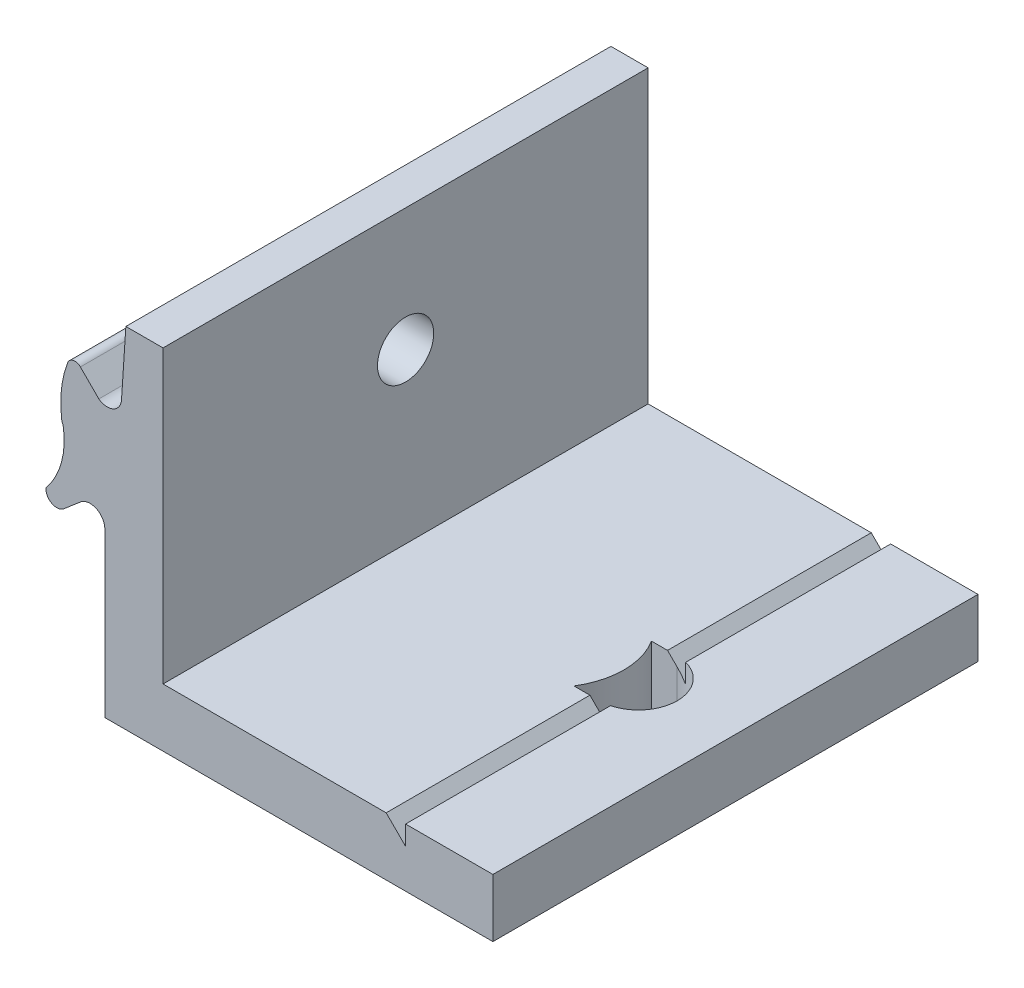
from build123d import *

# Parameters (mm, degrees)
CUT_EXTRUDE1_START        = 15
CUT_EXTRUDE1_DEPTH        = 10.5
CUT_EXTRUDE1_START_2      = 25.5
CUT_EXTRUDE1_2_DEPTH      = 4
CUT_EXTRUDE1_START_3      = -5
CUT_EXTRUDE1_3_DEPTH      = 3.568757805
BOSS_EXTRUDE1_DEPTH       = 0.5
BOSS_EXTRUDE2_DEPTH       = 0.5
SKETCH4_W                 = 14.5
SKETCH4_H                 = 15
CUT_EXTRUDE2_DEPTH        = 10.672144385
BOSS_EXTRUDE3_DEPTH       = 10.5
F_3_CLEARANCE_HOLE1_D     = 2.9
F_3_CLEARANCE_HOLE1_DEPTH = 6.031783808


with BuildPart() as part:
    # Cut-Extrude1: read off the stored shape, not the designer's step
    # Cut-Extrude1 outline → Cut-Extrude1 (new body)
    with BuildSketch(Plane.XY.offset(CUT_EXTRUDE1_START)):
        with BuildLine():
            Line((337.250458866, -1.431242195), (336.422603251, -1.431242195))
            Line((336.422603251, -1.431242195), (336.422603251, 13.568757805))
            Line((336.422603251, 13.568757805), (323.834138276, 13.568757805))
            Line((323.834138276, 13.568757805), (323.608997572, 10.166078708))
            ThreePointArc((323.608997572, 10.166078708), (323.181382472, 9.560091757), (322.443572772, 9.635667582))
            Line((322.443572772, 9.635667582), (321.491292518, 10.587947835))
            ThreePointArc((321.491292518, 10.587947835), (321.1243382, 10.696161689), (320.834327975, 10.446642593))
            ThreePointArc((320.834327975, 10.446642593), (320.5127775, 9.115460329), (320.529645575, 7.746096829))
            ThreePointArc((320.529645575, 7.746096829), (320.552977781, 7.656046386), (320.596479116, 7.57382043))
            ThreePointArc((320.596479116, 7.57382043), (320.51875348, 5.851708999), (319.722869168, 4.322566357))
            ThreePointArc((319.722869168, 4.322566357), (320.011740784, 3.764617073), (320.636356902, 3.832506086))
            Line((320.636356902, 3.832506086), (321.56122175, 4.617919231))
            ThreePointArc((321.56122175, 4.617919231), (322.32777998, 4.668660807), (322.750458866, 4.027155713))
            Line((322.750458866, 4.027155713), (322.750458866, -4.431242195))
            Line((322.750458866, -4.431242195), (342.750458866, -4.431242195))
            Line((342.750458866, -4.431242195), (342.750458866, -2.431242195))
            Line((342.750458866, -2.431242195), (338.250458866, -2.431242195))
            Line((338.250458866, -2.431242195), (337.250458866, -1.431242195))
        make_face()
    extrude(amount=CUT_EXTRUDE1_DEPTH)

    # Cut-Extrude1 2 outline → Cut-Extrude1 2 (add)
    with BuildSketch(Plane.XY.offset(CUT_EXTRUDE1_START_2)):
        with BuildLine():
            Line((337.250458866, -1.431242195), (336.422603251, -1.431242195))
            Line((336.422603251, -1.431242195), (336.422603251, 13.568757805))
            Line((336.422603251, 13.568757805), (323.834138276, 13.568757805))
            Line((323.834138276, 13.568757805), (323.608997572, 10.166078708))
            ThreePointArc((323.608997572, 10.166078708), (323.181382472, 9.560091757), (322.443572772, 9.635667582))
            Line((322.443572772, 9.635667582), (321.491292518, 10.587947835))
            ThreePointArc((321.491292518, 10.587947835), (321.1243382, 10.696161689), (320.834327975, 10.446642593))
            ThreePointArc((320.834327975, 10.446642593), (320.5127775, 9.115460329), (320.529645575, 7.746096829))
            ThreePointArc((320.529645575, 7.746096829), (320.552977781, 7.656046386), (320.596479116, 7.57382043))
            ThreePointArc((320.596479116, 7.57382043), (320.51875348, 5.851708999), (319.722869168, 4.322566357))
            ThreePointArc((319.722869168, 4.322566357), (320.011740784, 3.764617073), (320.636356902, 3.832506086))
            Line((320.636356902, 3.832506086), (321.56122175, 4.617919231))
            ThreePointArc((321.56122175, 4.617919231), (322.32777998, 4.668660807), (322.750458866, 4.027155713))
            Line((322.750458866, 4.027155713), (322.750458866, -4.431242195))
            Line((322.750458866, -4.431242195), (342.750458866, -4.431242195))
            Line((342.750458866, -4.431242195), (342.750458866, -2.431242195))
            Line((342.750458866, -2.431242195), (338.250458866, -2.431242195))
            Line((338.250458866, -2.431242195), (337.250458866, -1.431242195))
        make_face()
    extrude(amount=CUT_EXTRUDE1_2_DEPTH)

    # Cut-Extrude1 3 outline → Cut-Extrude1 3 (cut)
    with BuildSketch(Plane(origin=(0, 0, 0), x_dir=(1, 0, 0), z_dir=(0, 1, 0)).offset(CUT_EXTRUDE1_START_3)):
        with BuildLine():
            ThreePointArc((336.422603251, -25.5), (337.000458866, -27.5), (336.422603251, -29.5))
            Line((336.422603251, -29.5), (337.750458866, -29.5))
            ThreePointArc((337.750458866, -29.5), (339.750458866, -27.5), (337.750458866, -25.5))
            Line((337.750458866, -25.5), (336.422603251, -25.5))
        make_face()
    extrude(amount=CUT_EXTRUDE1_3_DEPTH, mode=Mode.SUBTRACT)

    # Sketch2 → Boss-Extrude1 (add)
    with BuildSketch(Plane(origin=(0, -2.431242195, 0), x_dir=(-1, 0, 0), z_dir=(0, 1, 0))):
        with BuildLine():
            Line((-338.250458866, 29.5), (-338.250458866, 29.436491673))
            ThreePointArc((-338.250458866, 29.436491673), (-339.750458866, 27.5), (-338.250458866, 25.563508327))
            Line((-338.250458866, 25.563508327), (-338.250458866, 15))
            Line((-338.250458866, 15), (-342.750458866, 15))
            Line((-342.750458866, 15), (-342.750458866, 29.5))
            Line((-342.750458866, 29.5), (-338.250458866, 29.5))
        make_face()
    extrude(amount=BOSS_EXTRUDE1_DEPTH)

    # Sketch3 → Boss-Extrude2 (add)
    with BuildSketch(Plane(origin=(0, -1.931242195, 0), x_dir=(-1, 0, 0), z_dir=(0, 1, 0))):
        with BuildLine():
            Line((-338.250458866, 29.5), (-338.250458866, 29.436491673))
            ThreePointArc((-338.250458866, 29.436491673), (-339.750458866, 27.5), (-338.250458866, 25.563508327))
            Line((-338.250458866, 25.563508327), (-338.250458866, 15))
            Line((-338.250458866, 15), (-342.750458866, 15))
            Line((-342.750458866, 15), (-342.750458866, 29.5))
            Line((-342.750458866, 29.5), (-338.250458866, 29.5))
        make_face()
    extrude(amount=BOSS_EXTRUDE2_DEPTH)

    # Sketch4 → Cut-Extrude2 (cut)
    with BuildSketch(Plane(origin=(336.422603251, 0, 0), x_dir=(0, 0, -1), z_dir=(1, 0, 0))):
        with Locations((-22.25, 6.068757805)):
            Rectangle(SKETCH4_W, SKETCH4_H)
    extrude(amount=-CUT_EXTRUDE2_DEPTH, mode=Mode.SUBTRACT)

    # Sketch5 → Boss-Extrude3 (add)
    with BuildSketch(Plane.XY.offset(29.5)):
        with BuildLine():
            Line((322.750458866, -4.431242195), (322.750458866, 4.027155713))
            ThreePointArc((322.750458866, 4.027155713), (322.32777998, 4.668660807), (321.56122175, 4.617919231))
            Line((321.56122175, 4.617919231), (320.636356902, 3.832506086))
            ThreePointArc((320.636356902, 3.832506086), (320.011740784, 3.764617073), (319.722869168, 4.322566357))
            ThreePointArc((319.722869168, 4.322566357), (320.51875348, 5.851708999), (320.596479116, 7.57382043))
            ThreePointArc((320.596479116, 7.57382043), (320.552977781, 7.656046387), (320.529645575, 7.746096829))
            ThreePointArc((320.529645575, 7.746096829), (320.5127775, 9.11546033), (320.834327975, 10.446642593))
            ThreePointArc((320.834327975, 10.446642593), (321.1243382, 10.696161689), (321.491292518, 10.587947835))
            Line((321.491292518, 10.587947835), (322.443572772, 9.635667582))
            ThreePointArc((322.443572772, 9.635667582), (323.181382472, 9.560091757), (323.608997572, 10.166078708))
            Line((323.608997572, 10.166078708), (323.834138276, 13.568757805))
            Line((323.834138276, 13.568757805), (325.750458866, 13.568757805))
            Line((325.750458866, 13.568757805), (325.750458866, -1.431242195))
            Line((325.750458866, -1.431242195), (337.250458866, -1.431242195))
            Line((337.250458866, -1.431242195), (338.250458866, -2.431242195))
            Line((338.250458866, -2.431242195), (338.250458866, -1.431242195))
            Line((338.250458866, -1.431242195), (342.750458866, -1.431242195))
            Line((342.750458866, -1.431242195), (342.750458866, -4.431242195))
            Line((342.750458866, -4.431242195), (322.750458866, -4.431242195))
        make_face()
    extrude(amount=BOSS_EXTRUDE3_DEPTH)

    # #3 Clearance Hole1
    with Locations(Plane(origin=(325.750458866, 0, 0), x_dir=(0, 0, -1), z_dir=(1, 0, 0))):
        with Locations((-27.5, 7.246096829)):
            Hole(F_3_CLEARANCE_HOLE1_D / 2, depth=F_3_CLEARANCE_HOLE1_DEPTH)


solid = part.part
